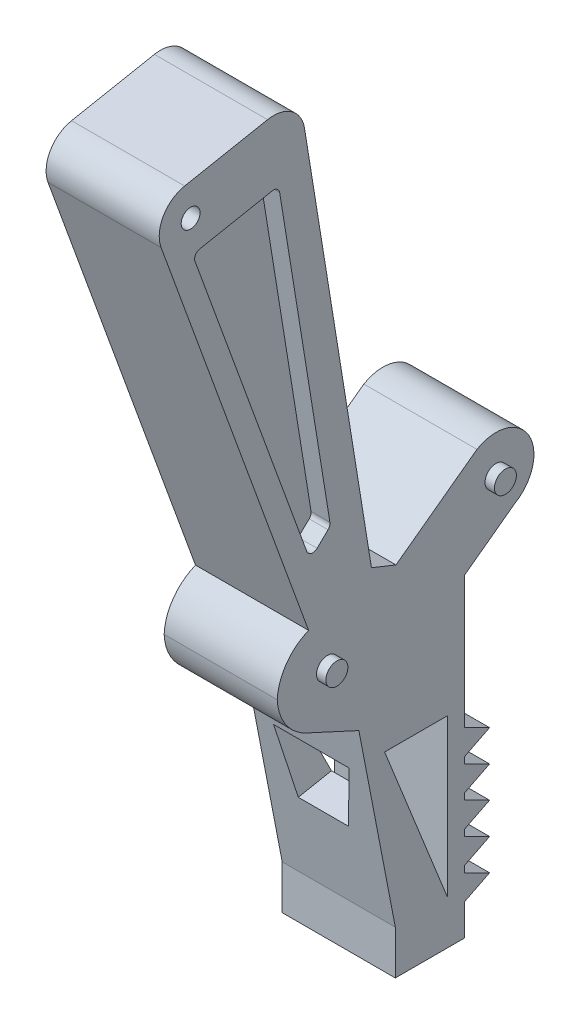
from build123d import *

# Parameters (mm, degrees)
BOSS_EXTRUDE1_DEPTH = 18
CUT_EXTRUDE1_DEPTH  = 18
BOSS_EXTRUDE2_DEPTH = 18
LPATTERN1_COUNT     = 5
LPATTERN1_PITCH     = 5
FILLET1_R           = 8
FILLET2_R           = 5
SKETCH4_R           = 1.5
CUT_EXTRUDE2_DEPTH  = 18
CUT_EXTRUDE3_DEPTH  = 6
SKETCH6_R           = 1.75
BOSS_EXTRUDE3_DEPTH = 1.5
SKETCH7_R           = 1.75
BOSS_EXTRUDE4_DEPTH = 1.5
CUT_EXTRUDE4_DEPTH  = 3


with BuildPart() as part:
    # Sketch1 → Boss-Extrude1 (new body)
    with BuildSketch(Plane(origin=(0, 0, 0), x_dir=(0, 0, -1), z_dir=(1, 0, 0))):
        with BuildLine():
            Line((24.799627928, -4.804973216), (32.853416759, 1.122630471))
            ThreePointArc((32.853416759, 1.122630471), (35.038056902, 9.373242879), (26.787444494, 11.557883023))
            Line((26.787444494, 11.557883023), (13.901382366, 2.073717122))
            Line((13.901382366, 2.073717122), (10, 3.639702343))
            Line((10, 3.639702343), (0, 0))
            Line((0, 0), (-5, -1.819851171))
            Line((-5, -1.819851171), (-5, -11.819851171))
            Line((-5, -11.819851171), (8, -17.804973216))
            Line((8, -17.804973216), (13.799627928, -47.804973216))
            Line((13.799627928, -47.804973216), (13.799627928, -54.804973216))
            Line((13.799627928, -54.804973216), (24.799627928, -54.804973216))
            Line((24.799627928, -54.804973216), (24.799627928, -4.804973216))
        make_face()
        Polygon((10, 3.639702343), (0, 0), (-25.477916399, 70), (-1.477916399, 74.639702343), align=None)
    extrude(amount=BOSS_EXTRUDE1_DEPTH)

    # Sketch2 → Cut-Extrude1 (cut)
    with BuildSketch(Plane(origin=(18, 0, 0), x_dir=(0, 0, -1), z_dir=(1, 0, 0))):
        Polygon((12.09390479, -22.804973216), (22.09390479, -22.804973216), (22.09390479, -47.804973216), align=None)
    extrude(amount=-CUT_EXTRUDE1_DEPTH, mode=Mode.SUBTRACT)

    # Sketch3 → Boss-Extrude2 (add)
    with BuildSketch(Plane(origin=(18, 0, 0), x_dir=(0, 0, -1), z_dir=(1, 0, 0))):
        Polygon((24.799627928, -47.804973216), (24.799627928, -49.804973216), (28.799627928, -47.804973216), align=None)
        Polygon((24.799627928, -47.804973216), (28.799627928, -47.804973216), (24.799627928, -45.804973216), align=None)
    boss_extrude2 = extrude(amount=-BOSS_EXTRUDE2_DEPTH)

    # LPattern1: Boss-Extrude2 ×5
    with Locations(*[(0, i * LPATTERN1_PITCH, 0) for i in range(1, LPATTERN1_COUNT)]):
        add(boss_extrude2)

    # Fillet1
    # the kernel refuses this fillet: 8 mm, written as the material it takes off along each edge
    with BuildSketch(Plane(origin=(-13.990868289, -1.819851171, 5), x_dir=(0, 0.34202014332566644, -0.9396926207859092), z_dir=(1, 0, 0))) as fillet1_piece_1:
        with BuildLine():
            CenterArc((5.603477455, -7.995007423), FILLET1_R, 92.024312837, 67.975687163)
            Line((-1.914063511, -5.258846276), (-2.06441433, -5.204123053))
            Line((-2.06441433, -5.204123053), (-0.150350819, 0.054723223))
            Line((-0.150350819, 0.054723223), (0, 0.16))
            ThreePointArc((0, 0.16), (2.660444431, 0.16), (5.315237091, 0.159900148))
            Line((5.315237091, 0.159900148), (5.320888862, 0))
        make_face()
    extrude(amount=45.981736579, mode=Mode.SUBTRACT)
    with BuildSketch(Plane(origin=(-12.809954869, -11.819851171, 5), x_dir=(0, 1, 0), z_dir=(1, 0, 0))) as fillet1_piece_2:
        with BuildLine():
            CenterArc((FILLET1_R * 0.640497743455, -FILLET1_R), FILLET1_R, 90, 65.278940391)
            Line((-FILLET1_R * 0.267856781688, -FILLET1_R * 0.581799023611), (-FILLET1_R * 0.286023872191, -FILLET1_R * 0.573435004083))
            Line((-FILLET1_R * 0.286023872191, -FILLET1_R * 0.573435004083), (-FILLET1_R * 0.0128099548691, FILLET1_R * 0.02))
            Line((-FILLET1_R * 0.0128099548691, FILLET1_R * 0.02), (FILLET1_R * 0.640497743455, FILLET1_R * 0.02))
            Line((FILLET1_R * 0.640497743455, FILLET1_R * 0.02), (FILLET1_R * 0.640497743455, 0))
        make_face()
    extrude(amount=43.619909738, mode=Mode.SUBTRACT)

    # Fillet2
    fillet2_edges = [part.edges().sort_by_distance(p)[0] for p in [
        (9, 70, 25.477916399),
        (9, 74.639702343, 1.477916399),
    ]]
    fillet(fillet2_edges, radius=FILLET2_R)

    # Sketch4 → Cut-Extrude2 (cut)
    with BuildSketch(Plane(origin=(18, 0, 0), x_dir=(0, 0, -1), z_dir=(1, 0, 0))):
        with Locations((-18.775111552, 66.203217038)):
            Circle(SKETCH4_R)
    extrude(amount=-CUT_EXTRUDE2_DEPTH, mode=Mode.SUBTRACT)

    # Sketch5 → Cut-Extrude3 (cut)
    with BuildSketch(Plane(origin=(0, 0.849397963, -4.393719597), x_dir=(1, 0, 0), z_dir=(0, -0.1898066444194718, 0.981821489749649))):
        Polygon((15, -26.499758484), (9, -26.499758484), (3, -26.499758484), (5, -36.691893202), (9, -36.691893202), (13, -36.691893202), align=None)
    extrude(amount=-CUT_EXTRUDE3_DEPTH, mode=Mode.SUBTRACT)

    # Sketch6 → Boss-Extrude3 (add)
    with BuildSketch(Plane(origin=(18, 0, 0), x_dir=(0, 0, -1), z_dir=(1, 0, 0))):
        with Locations((29.820430626, 6.340256747)):
            Circle(SKETCH6_R)
    boss_extrude3 = extrude(amount=BOSS_EXTRUDE3_DEPTH)

    # Sketch7 → Boss-Extrude4 (add)
    with BuildSketch(Plane(origin=(18, 0, 0), x_dir=(0, 0, -1), z_dir=(1, 0, 0))):
        with Locations((3, -6.695869224)):
            Circle(SKETCH7_R)
    boss_extrude4 = extrude(amount=BOSS_EXTRUDE4_DEPTH)

    # Sketch8 → Cut-Extrude4 (cut)
    with BuildSketch(Plane(origin=(18, 0, 0), x_dir=(0, 0, -1), z_dir=(1, 0, 0))):
        with BuildLine():
            Line((-17.332707084, 61.238673153), (-5.781480677, 63.471766995))
            ThreePointArc((-5.781480677, 63.471766995), (-5.018988164, 63.309720411), (-4.604490469, 62.649534384))
            Line((-4.604490469, 62.649534384), (3.388275701, 13.207947746))
            ThreePointArc((3.388275701, 13.207947746), (3.349595335, 12.731591312), (3.094265813, 12.327588269))
            Line((3.094265813, 12.327588269), (1.345046537, 10.645343239))
            ThreePointArc((1.345046537, 10.645343239), (0.425917391, 10.391976204), (-0.28781976, 11.024093693))
            Line((-0.28781976, 11.024093693), (-18.08259306, 59.914831519))
            ThreePointArc((-18.08259306, 59.914831519), (-18.013004637, 60.74971948), (-17.332707084, 61.238673153))
        make_face()
    cut_extrude4 = extrude(amount=-CUT_EXTRUDE4_DEPTH, mode=Mode.SUBTRACT)

    # Mirror1: Boss-Extrude3, Boss-Extrude4, Cut-Extrude4 across plane
    add(boss_extrude3.mirror(Plane(origin=(9, 0, 0), x_dir=(0, 0, 1), z_dir=(1, 0, 0))))
    add(boss_extrude4.mirror(Plane(origin=(9, 0, 0), x_dir=(0, 0, 1), z_dir=(1, 0, 0))))
    add(cut_extrude4.mirror(Plane(origin=(9, 0, 0), x_dir=(0, 0, 1), z_dir=(1, 0, 0))), mode=Mode.SUBTRACT)


solid = part.part
